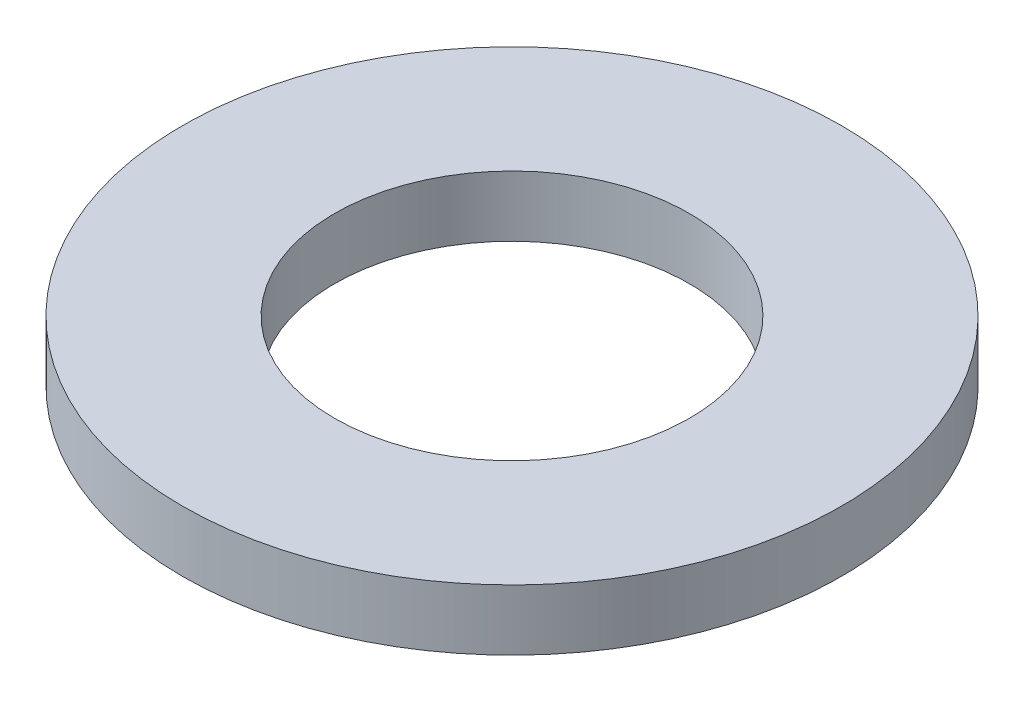
from build123d import *

# Parameters (mm, degrees)
SKETCH1_R           = 65
BOSS_EXTRUDE1_DEPTH = 12
SKETCH2_R           = 35
CUT_EXTRUDE1_DEPTH  = 93.703829479


with BuildPart() as part:
    # Sketch1 → Boss-Extrude1 (new body)
    with BuildSketch(Plane(origin=(0, 0, 0), x_dir=(1, 0, 0), z_dir=(0, 1, 0))):
        Circle(SKETCH1_R)
    extrude(amount=BOSS_EXTRUDE1_DEPTH)

    # Sketch2 → Cut-Extrude1 (cut, through all)
    with BuildSketch(Plane(origin=(0, 0, 0), x_dir=(1, 0, 0), z_dir=(0, 1, 0))):
        Circle(SKETCH2_R)
    extrude(amount=CUT_EXTRUDE1_DEPTH, mode=Mode.SUBTRACT)


solid = part.part
